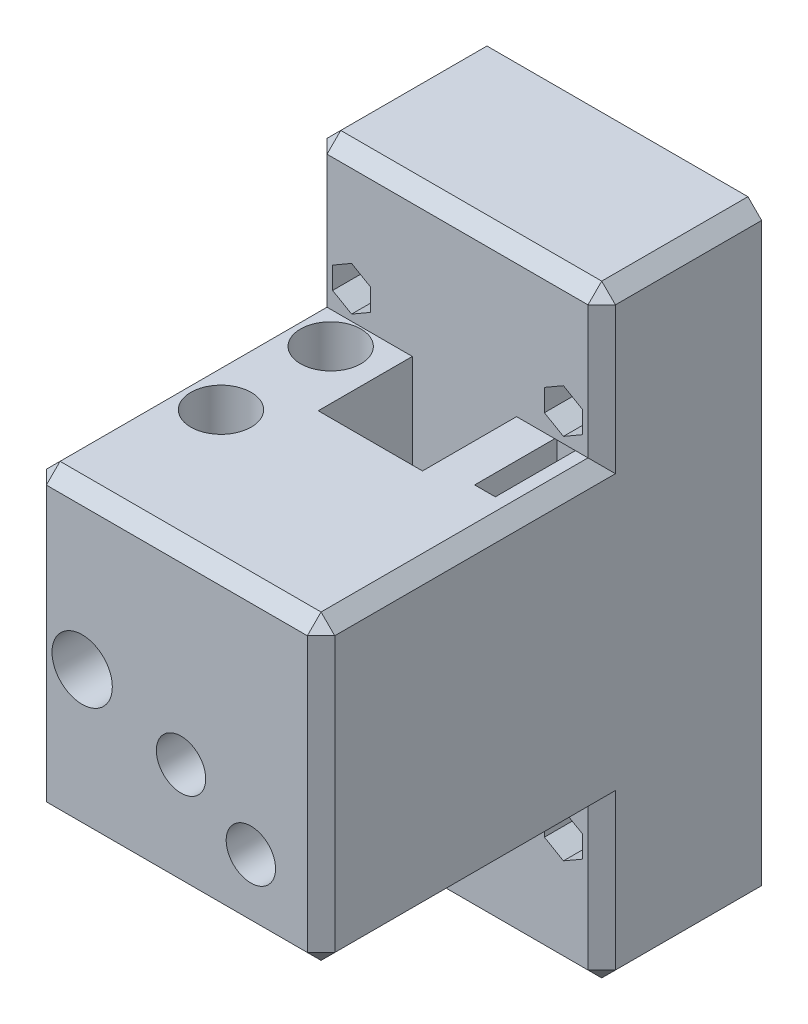
from build123d import *

# Parameters (mm, degrees)
SKETCH1_W                = 34.3
SKETCH1_H                = 70.3
SKETCH1_W_2              = 110
SKETCH1_H_2              = 9.85
BOSS_EXTRUDE1_DEPTH      = 15.048264774
BOSS_EXTRUDE3_DEPTH      = 10
BOSS_EXTRUDE4_DEPTH      = 27.518264774
CUT_EXTRUDE1_DEPTH       = 97.82308708
CUT_EXTRUDE1_DEPTH_BACK  = 97.82308708
SKETCH4_R                = 2
CUT_EXTRUDE3_DEPTH       = 77.2053469
CUT_EXTRUDE3_DEPTH_BACK  = 77.2053469
SKETCH8_W                = 129.903835659
SKETCH8_H                = 83.627886417
SKETCH9_W                = 44.357950904
SKETCH9_H                = 70.607950904
SKETCH9_W_2              = 20
SKETCH9_H_2              = 40
BOSS_EXTRUDE5_DEPTH      = 15.048264774
SKETCH10_W               = 20.2
SKETCH10_H               = 40.2
SKETCH10_W_2             = 20
SKETCH10_H_2             = 40
CUT_EXTRUDE6_DEPTH       = 81.359319258
SKETCH11_R               = 3
CUT_EXTRUDE7_DEPTH       = 30
CUT_EXTRUDE8_DEPTH       = 105.313703151
CUT_EXTRUDE8_DEPTH_BACK  = 8
SKETCH12_R               = 5.5
CUT_EXTRUDE10_DEPTH      = 81.359319258
CUT_EXTRUDE10_DEPTH_BACK = 81.359319258
SKETCH14_W               = 7.032197939
SKETCH14_H               = 32
SKETCH19_W               = 44.357950904
SKETCH19_H               = 70.453975452
BOSS_EXTRUDE9_DEPTH      = 3
BOSS_EXTRUDE6_DEPTH      = 19.3
SKETCH16_R               = 3.4
BOSS_EXTRUDE7_DEPTH      = 2.35
SKETCH18_W               = 18.048264774
SKETCH18_H               = 5.321024548
BOSS_EXTRUDE8_DEPTH      = 15
SKETCH20_R               = 3.4
BOSS_EXTRUDE10_DEPTH     = 1.85
BOSS_EXTRUDE11_DEPTH     = 15.85
SKETCH22_R               = 3.4
BOSS_EXTRUDE12_DEPTH     = 1.8
BOSS_EXTRUDE13_DEPTH     = 34.003975452
SKETCH26_W               = 18.048264774
SKETCH26_H               = 2.15
BOSS_EXTRUDE16_DEPTH     = 5.321024548
SKETCH24_R               = 3.4
BOSS_EXTRUDE14_DEPTH     = 1.8
BOSS_EXTRUDE15_DEPTH     = 18.503975452
CUT_EXTRUDE11_DEPTH      = 83.549671178
CUT_EXTRUDE11_DEPTH_BACK = 83.549671178
SKETCH27_R               = 2.5
CUT_EXTRUDE12_DEPTH      = 81.923545348
CUT_EXTRUDE12_DEPTH_BACK = 81.923545348
SKETCH28_R               = 2.5
CUT_EXTRUDE15_DEPTH      = 102.880674814
CUT_EXTRUDE15_DEPTH_BACK = 102.880674814
SKETCH29_W               = 3.770821646
SKETCH29_H               = 15
SKETCH30_W               = 52.566529548
SKETCH30_H               = 26.651024548
SKETCH30_R               = 2
SKETCH30_H_2             = 28.348975452
BOSS_EXTRUDE17_DEPTH     = 19.3
CHAMFER1_SIZE            = 2.5
CUT_EXTRUDE16_DEPTH      = 84.96040374
CUT_EXTRUDE16_DEPTH_BACK = 10
SKETCH31_R               = 3
CUT_EXTRUDE17_DEPTH      = 33
SKETCH33_R               = 5.5
CUT_EXTRUDE18_DEPTH      = 8
CUT_EXTRUDE19_DEPTH      = 20
CUT_EXTRUDE20_DEPTH      = 33
SKETCH36_R               = 4.5
CUT_EXTRUDE21_DEPTH      = 12
SKETCH37_R               = 4.5
CUT_EXTRUDE22_DEPTH      = 4


# Read off the part's stored shape, not the designer's step: Boss-Extrude13
with BuildPart() as part:
    # Sketch1 → Boss-Extrude1 (new body)
    # profile 1 of 2: a face of its own
    with BuildSketch(Plane.YZ):
        Rectangle(SKETCH1_W, SKETCH1_H)
        with BuildLine():
            Line((-10.15, 6.7), (-10.15, -6.7))
            ThreePointArc((-10.15, -6.7), (-9.871751442, -7.371751442), (-9.2, -7.65))
            Line((-9.2, -7.65), (-8.5, -7.65))
            ThreePointArc((-8.5, -7.65), (-8.181801948, -7.518198052), (-8.05, -7.2))
            Line((-8.05, -7.2), (-8.05, -5.094911614))
            ThreePointArc((-8.05, -5.094911614), (-7.621019548, -4.452896997), (-6.863711672, -4.603534899))
            Line((-6.863711672, -4.603534899), (-4.684745674, -6.782500897))
            ThreePointArc((-4.684745674, -6.782500897), (-4.066943332, -7.707107441), (-3.85, -8.797755224))
            Line((-3.85, -8.797755224), (-3.85, -11.202244776))
            ThreePointArc((-3.85, -11.202244776), (-4.066943332, -12.292892559), (-4.684745674, -13.217499103))
            Line((-4.684745674, -13.217499103), (-6.863711672, -15.396465101))
            ThreePointArc((-6.863711672, -15.396465101), (-7.621019548, -15.547103003), (-8.05, -14.905088386))
            Line((-8.05, -14.905088386), (-8.05, -12.8))
            ThreePointArc((-8.05, -12.8), (-8.181801948, -12.481801948), (-8.5, -12.35))
            Line((-8.5, -12.35), (-9.2, -12.35))
            ThreePointArc((-9.2, -12.35), (-9.871751442, -12.628248558), (-10.15, -13.3))
            Line((-10.15, -13.3), (-10.15, -18))
            ThreePointArc((-10.15, -18), (-9.52027958, -19.52027958), (-8, -20.15))
            Line((-8, -20.15), (-3.3, -20.15))
            ThreePointArc((-3.3, -20.15), (-2.628248558, -19.871751442), (-2.35, -19.2))
            Line((-2.35, -19.2), (-2.35, -18.5))
            ThreePointArc((-2.35, -18.5), (-2.481801948, -18.181801948), (-2.8, -18.05))
            Line((-2.8, -18.05), (-4.905088386, -18.05))
            ThreePointArc((-4.905088386, -18.05), (-5.547103003, -17.621019548), (-5.396465101, -16.863711672))
            Line((-5.396465101, -16.863711672), (-3.217499103, -14.684745674))
            ThreePointArc((-3.217499103, -14.684745674), (-2.292892559, -14.066943332), (-1.202244776, -13.85))
            Line((-1.202244776, -13.85), (1.202244776, -13.85))
            ThreePointArc((1.202244776, -13.85), (2.292892559, -14.066943332), (3.217499103, -14.684745674))
            Line((3.217499103, -14.684745674), (5.396465101, -16.863711672))
            ThreePointArc((5.396465101, -16.863711672), (5.547103003, -17.621019548), (4.905088386, -18.05))
            Line((4.905088386, -18.05), (2.8, -18.05))
            ThreePointArc((2.8, -18.05), (2.481801948, -18.181801948), (2.35, -18.5))
            Line((2.35, -18.5), (2.35, -19.2))
            ThreePointArc((2.35, -19.2), (2.628248558, -19.871751442), (3.3, -20.15))
            Line((3.3, -20.15), (8, -20.15))
            ThreePointArc((8, -20.15), (9.52027958, -19.52027958), (10.15, -18))
            Line((10.15, -18), (10.15, -13.3))
            ThreePointArc((10.15, -13.3), (9.871751442, -12.628248558), (9.2, -12.35))
            Line((9.2, -12.35), (8.5, -12.35))
            ThreePointArc((8.5, -12.35), (8.181801948, -12.481801948), (8.05, -12.8))
            Line((8.05, -12.8), (8.05, -14.905088386))
            ThreePointArc((8.05, -14.905088386), (7.621019548, -15.547103003), (6.863711672, -15.396465101))
            Line((6.863711672, -15.396465101), (4.684745674, -13.217499103))
            ThreePointArc((4.684745674, -13.217499103), (4.066943332, -12.292892559), (3.85, -11.202244776))
            Line((3.85, -11.202244776), (3.85, -8.797755224))
            ThreePointArc((3.85, -8.797755224), (4.066943332, -7.707107441), (4.684745674, -6.782500897))
            Line((4.684745674, -6.782500897), (6.863711672, -4.603534899))
            ThreePointArc((6.863711672, -4.603534899), (7.621019548, -4.452896997), (8.05, -5.094911614))
            Line((8.05, -5.094911614), (8.05, -7.2))
            ThreePointArc((8.05, -7.2), (8.181801948, -7.518198052), (8.5, -7.65))
            Line((8.5, -7.65), (9.2, -7.65))
            ThreePointArc((9.2, -7.65), (9.871751442, -7.371751442), (10.15, -6.7))
            Line((10.15, -6.7), (10.15, 6.7))
            ThreePointArc((10.15, 6.7), (9.871751442, 7.371751442), (9.2, 7.65))
            Line((9.2, 7.65), (8.5, 7.65))
            ThreePointArc((8.5, 7.65), (8.181801948, 7.518198052), (8.05, 7.2))
            Line((8.05, 7.2), (8.05, 5.094911614))
            ThreePointArc((8.05, 5.094911614), (7.621019548, 4.452896997), (6.863711672, 4.603534899))
            Line((6.863711672, 4.603534899), (4.684745674, 6.782500897))
            ThreePointArc((4.684745674, 6.782500897), (4.066943332, 7.707107441), (3.85, 8.797755224))
            Line((3.85, 8.797755224), (3.85, 11.202244776))
            ThreePointArc((3.85, 11.202244776), (4.066943332, 12.292892559), (4.684745674, 13.217499103))
            Line((4.684745674, 13.217499103), (6.863711672, 15.396465101))
            ThreePointArc((6.863711672, 15.396465101), (7.621019548, 15.547103003), (8.05, 14.905088386))
            Line((8.05, 14.905088386), (8.05, 12.8))
            ThreePointArc((8.05, 12.8), (8.181801948, 12.481801948), (8.5, 12.35))
            Line((8.5, 12.35), (9.2, 12.35))
            ThreePointArc((9.2, 12.35), (9.871751442, 12.628248558), (10.15, 13.3))
            Line((10.15, 13.3), (10.15, 18))
            ThreePointArc((10.15, 18), (9.52027958, 19.52027958), (8, 20.15))
            Line((8, 20.15), (3.3, 20.15))
            ThreePointArc((3.3, 20.15), (2.628248558, 19.871751442), (2.35, 19.2))
            Line((2.35, 19.2), (2.35, 18.5))
            ThreePointArc((2.35, 18.5), (2.481801948, 18.181801948), (2.8, 18.05))
            Line((2.8, 18.05), (4.905088386, 18.05))
            ThreePointArc((4.905088386, 18.05), (5.547103003, 17.621019548), (5.396465101, 16.863711672))
            Line((5.396465101, 16.863711672), (3.217499103, 14.684745674))
            ThreePointArc((3.217499103, 14.684745674), (2.292892559, 14.066943332), (1.202244776, 13.85))
            Line((1.202244776, 13.85), (-1.202244776, 13.85))
            ThreePointArc((-1.202244776, 13.85), (-2.292892559, 14.066943332), (-3.217499103, 14.684745674))
            Line((-3.217499103, 14.684745674), (-5.396465101, 16.863711672))
            ThreePointArc((-5.396465101, 16.863711672), (-5.547103003, 17.621019548), (-4.905088386, 18.05))
            Line((-4.905088386, 18.05), (-2.8, 18.05))
            ThreePointArc((-2.8, 18.05), (-2.481801948, 18.181801948), (-2.35, 18.5))
            Line((-2.35, 18.5), (-2.35, 19.2))
            ThreePointArc((-2.35, 19.2), (-2.628248558, 19.871751442), (-3.3, 20.15))
            Line((-3.3, 20.15), (-8, 20.15))
            ThreePointArc((-8, 20.15), (-9.52027958, 19.52027958), (-10.15, 18))
            Line((-10.15, 18), (-10.15, 13.3))
            ThreePointArc((-10.15, 13.3), (-9.871751442, 12.628248558), (-9.2, 12.35))
            Line((-9.2, 12.35), (-8.5, 12.35))
            ThreePointArc((-8.5, 12.35), (-8.181801948, 12.481801948), (-8.05, 12.8))
            Line((-8.05, 12.8), (-8.05, 14.905088386))
            ThreePointArc((-8.05, 14.905088386), (-7.621019548, 15.547103003), (-6.863711672, 15.396465101))
            Line((-6.863711672, 15.396465101), (-4.684745674, 13.217499103))
            ThreePointArc((-4.684745674, 13.217499103), (-4.066943332, 12.292892559), (-3.85, 11.202244776))
            Line((-3.85, 11.202244776), (-3.85, 8.797755224))
            ThreePointArc((-3.85, 8.797755224), (-4.066943332, 7.707107441), (-4.684745674, 6.782500897))
            Line((-4.684745674, 6.782500897), (-6.863711672, 4.603534899))
            ThreePointArc((-6.863711672, 4.603534899), (-7.621019548, 4.452896997), (-8.05, 5.094911614))
            Line((-8.05, 5.094911614), (-8.05, 7.2))
            ThreePointArc((-8.05, 7.2), (-8.181801948, 7.518198052), (-8.5, 7.65))
            Line((-8.5, 7.65), (-9.2, 7.65))
            ThreePointArc((-9.2, 7.65), (-9.871751442, 7.371751442), (-10.15, 6.7))
        make_face(mode=Mode.SUBTRACT)
    # profile 2 of 2: a face of its own
    with BuildSketch(Plane.YZ):
        with Locations((0, -40.075)):
            Rectangle(SKETCH1_W_2, SKETCH1_H_2)
    extrude(amount=-BOSS_EXTRUDE1_DEPTH)

    # Sketch2 → Boss-Extrude3 (add)
    with BuildSketch(Plane.YZ):
        Polygon((17.15, 35.15), (-17.15, 35.15), (-17.15, -35.15), (-55, -35.15), (-55, -45), (55, -45), (55, -35.15), (17.15, -35.15), align=None)
    extrude(amount=BOSS_EXTRUDE3_DEPTH)

    # Sketch3 → Boss-Extrude4 (add)
    with BuildSketch(Plane.YZ.offset(10)):
        Polygon((-17.15, -35.15), (17.15, -35.15), (55, -35.15), (55, -45), (-55, -45), (-55, -35.15), align=None)
    extrude(amount=BOSS_EXTRUDE4_DEPTH)

    # Sketch4 → Cut-Extrude1 (cut, two sides: drawn at the far end of the back side and taken through both)
    with BuildSketch(Plane.XY.offset(-35.15).offset(-CUT_EXTRUDE1_DEPTH_BACK)):
        with Locations((-8.06818722, 33.5)):
            Circle(SKETCH4_R)
        with Locations((-8.06818722, -33.5)):
            Circle(SKETCH4_R)
        with Locations((30.53818722, -33.5)):
            Circle(SKETCH4_R)
        with Locations((30.53818722, 33.5)):
            Circle(SKETCH4_R)
    extrude(amount=CUT_EXTRUDE1_DEPTH + CUT_EXTRUDE1_DEPTH_BACK, mode=Mode.SUBTRACT)

    # Sketch8 → Cut-Extrude3 (cut, two sides: drawn at the far end of the back side and taken through both)
    with BuildSketch(Plane.YZ.offset(10).offset(-CUT_EXTRUDE3_DEPTH_BACK)):
        with Locations((-9.95191783, 6.663943208)):
            Rectangle(SKETCH8_W, SKETCH8_H)
    extrude(amount=CUT_EXTRUDE3_DEPTH + CUT_EXTRUDE3_DEPTH_BACK, mode=Mode.SUBTRACT)

    # Sketch9 → Boss-Extrude5 (add)
    with BuildSketch(Plane(origin=(-15.048264774, 0, 0), x_dir=(0, -1, 0), z_dir=(-1, 0, 0))):
        with Locations((-0.848975452, 0)):
            Rectangle(SKETCH9_W, SKETCH9_H)
        Rectangle(SKETCH9_W_2, SKETCH9_H_2, mode=Mode.SUBTRACT)
    extrude(amount=-BOSS_EXTRUDE5_DEPTH)

    # Sketch10 → Cut-Extrude6 (cut, through all)
    with BuildSketch(Plane.YZ):
        Rectangle(SKETCH10_W, SKETCH10_H)
        Rectangle(SKETCH10_W_2, SKETCH10_H_2, mode=Mode.SUBTRACT)
    extrude(amount=-CUT_EXTRUDE6_DEPTH, mode=Mode.SUBTRACT)

    # Sketch11 → Cut-Extrude7 (cut)
    with BuildSketch(Plane.XY.offset(35.303975452)):
        with Locations((-6.024132387, 0)):
            Circle(SKETCH11_R)
    extrude(amount=-CUT_EXTRUDE7_DEPTH, mode=Mode.SUBTRACT)

    # Sketch12 → Cut-Extrude8 (cut, two sides: drawn at the far end of the back side and taken through both)
    with BuildSketch(Plane.XY.offset(35.303975452).offset(-CUT_EXTRUDE8_DEPTH_BACK)):
        with Locations((-6.024132387, 0)):
            Circle(SKETCH12_R)
    extrude(amount=CUT_EXTRUDE8_DEPTH + CUT_EXTRUDE8_DEPTH_BACK, mode=Mode.SUBTRACT)

    # Sketch14 → Cut-Extrude10 (cut, two sides: drawn at the far end of the back side and taken through both)
    with BuildSketch(Plane.YZ.offset(-CUT_EXTRUDE10_DEPTH_BACK)):
        with Locations((-12.813901031, 0.15)):
            Rectangle(SKETCH14_W, SKETCH14_H)
    extrude(amount=CUT_EXTRUDE10_DEPTH + CUT_EXTRUDE10_DEPTH_BACK, mode=Mode.SUBTRACT)

    # Sketch19 → Boss-Extrude9 (add)
    # profile 1 of 2: a face of its own
    with BuildSketch(Plane.YZ):
        with Locations((0.848975452, 0.076987726)):
            Rectangle(SKETCH19_W, SKETCH19_H)
        Polygon((-16.33, -15.85), (-16.33, 16.15), (-10.1, 16.15), (-10.1, 20.1), (10.1, 20.1), (10.1, -20.1), (-10.1, -20.1), (-10.1, -15.85), align=None, mode=Mode.SUBTRACT)
    # profile 2 of 2: a face of its own
    with BuildSketch(Plane.YZ):
        Polygon((-10.1, 16.15), (-10.1, -15.85), (-10.1, -20.1), (10.1, -20.1), (10.1, 20.1), (-10.1, 20.1), align=None)
    extrude(amount=BOSS_EXTRUDE9_DEPTH)

    # Sketch15 → Boss-Extrude6 (add)
    with BuildSketch(Plane.XY.offset(-35.15)):
        Polygon((37.518264774, 28.348975452), (-15.048264774, 28.348975452), (-15.048264774, 23.027950904), (3, 23.027950904), (3, -21.33), (-15.048264774, -21.33), (-15.048264774, -26.651024548), (37.518264774, -26.651024548), align=None)
    extrude(amount=BOSS_EXTRUDE6_DEPTH)

    # Sketch16 → Boss-Extrude7 (add)
    with BuildSketch(Plane.XY.offset(-15.85)):
        with Locations(Location((12, -6, 0), (0, 0, 180))):
            Circle(SKETCH16_R)
    extrude(amount=BOSS_EXTRUDE7_DEPTH)

    # Sketch18 → Boss-Extrude8 (add)
    with BuildSketch(Plane.XY.offset(-15.85)):
        with BuildLine():
            ThreePointArc((22, -6), (19.196963711, -12.942889409), (12.359257331, -15.993544625))
            Line((12.359257331, -15.993544625), (3, -16.33))
            Line((3, -16.33), (3, -21.33))
            Line((3, -21.33), (-15.048264774, -21.33))
            Line((-15.048264774, -21.33), (-15.048264774, -26.651024548))
            Line((-15.048264774, -26.651024548), (37.518264774, -26.651024548))
            Line((37.518264774, -26.651024548), (37.518264774, 28.348975452))
            Line((37.518264774, 28.348975452), (22, 28.348975452))
            Line((22, 28.348975452), (22, -6))
        make_face()
        with Locations((-6.024132387, 25.688463178)):
            Rectangle(SKETCH18_W, SKETCH18_H)
    extrude(amount=BOSS_EXTRUDE8_DEPTH)

    # Sketch20 → Boss-Extrude10 (add)
    with BuildSketch(Plane.XY.offset(-0.85)):
        with Locations((24.73, -13.83)):
            Circle(SKETCH20_R)
    extrude(amount=BOSS_EXTRUDE10_DEPTH)

    # Sketch21 → Boss-Extrude11 (add)
    with BuildSketch(Plane.XY.offset(-0.85)):
        Polygon((-15.048264774, -26.651024548), (14.73, -26.651024548), (14.73, -16.33), (3, -16.33), (3, -21.33), (-15.048264774, -21.33), align=None)
        with BuildLine():
            Line((34.73, -13.83), (34.73, -26.651024548))
            Line((34.73, -26.651024548), (37.518264774, -26.651024548))
            Line((37.518264774, -26.651024548), (37.518264774, 28.348975452))
            Line((37.518264774, 28.348975452), (22, 28.348975452))
            Line((22, 28.348975452), (22, -3.83))
            Line((22, -3.83), (24.73, -3.83))
            ThreePointArc((24.73, -3.83), (31.801067812, -6.758932188), (34.73, -13.83))
        make_face()
    extrude(amount=BOSS_EXTRUDE11_DEPTH)

    # Boss-Extrude13 outline → Boss-Extrude13 (add)
    with BuildSketch(Plane.XY.offset(1.3)):
        with BuildLine():
            Line((22, -6), (22, 28.348975452))
            Line((22, 28.348975452), (-15.048264774, 28.348975452))
            Line((-15.048264774, 28.348975452), (-15.048264774, 23.027950904))
            Line((-15.048264774, 23.027950904), (3, 23.027950904))
            Line((3, 23.027950904), (3, -10.1))
            Line((3, -10.1), (21.566632564, -8.91196521))
            ThreePointArc((21.566632564, -8.91196521), (21.891064797, -7.472018064), (22, -6))
        make_face()
    extrude(amount=BOSS_EXTRUDE13_DEPTH)

    # Sketch26 → Boss-Extrude16 (add)
    with BuildSketch(Plane(origin=(0, 23.027950904, 0), x_dir=(-1, 0, 0), z_dir=(0, 1, 0))):
        with Locations((6.024132387, 0.225)):
            Rectangle(SKETCH26_W, SKETCH26_H)
    extrude(amount=BOSS_EXTRUDE16_DEPTH)

    # Sketch24 → Boss-Extrude14 (add)
    with BuildSketch(Plane.XY.offset(15)):
        with Locations((24.73, -18.73)):
            Circle(SKETCH24_R)
        Polygon((14.73, -16.33), (3, -16.33), (3, -21.33), (-15.048264774, -21.33), (-15.048264774, -26.651024548), (14.73, -26.651024548), align=None)
        with BuildLine():
            Line((34.73, -13.83), (34.73, -26.651024548))
            Line((34.73, -26.651024548), (37.518264774, -26.651024548))
            Line((37.518264774, -26.651024548), (37.518264774, 28.348975452))
            Line((37.518264774, 28.348975452), (22, 28.348975452))
            Line((22, 28.348975452), (22, -3.83))
            Line((22, -3.83), (24.73, -3.83))
            ThreePointArc((24.73, -3.83), (31.801067812, -6.758932188), (34.73, -13.83))
        make_face()
    extrude(amount=BOSS_EXTRUDE14_DEPTH)


with BuildPart() as body_2:
    # Sketch22 → Boss-Extrude12 (new body)
    with BuildSketch(Plane(origin=(0, 0, -0.5), x_dir=(0, -1, 0), z_dir=(0, 0, 1))):
        with Locations(Location((28.33, 12, 0), (0, 0, 90))):
            Circle(SKETCH22_R)
    extrude(amount=BOSS_EXTRUDE12_DEPTH)


with BuildPart() as boss_extrude14_piece_1:
    # of the separate pieces the step leaves, piece 1, a body of its own (boss_extrude14_pieces)
    add(part.part.solids().sort_by_distance((-15.048264774, -55, -45))[0])



with BuildPart() as boss_extrude14_piece_2:
    # of the separate pieces the step leaves, piece 2, a body of its own (boss_extrude14_pieces)
    add(part.part.solids().sort_by_distance((28.13, -18.73, 15))[0])


with BuildPart() as boss_extrude14_piece_1_1:
    add(boss_extrude14_piece_1.part)

    add(boss_extrude14_piece_2.part)  # Boss-Extrude15 merges Boss-Extrude14 piece 2
    # Sketch25 → Boss-Extrude15 (add)
    with BuildSketch(Plane.XY.offset(16.8)):
        Polygon((-15.048264774, -26.651024548), (14.73, -26.651024548), (14.73, -16.33), (3, -16.33), (3, -21.33), (-15.048264774, -21.33), align=None)
        with BuildLine():
            Line((37.518264774, 28.348975452), (22, 28.348975452))
            Line((22, 28.348975452), (22, -6))
            ThreePointArc((22, -6), (21.904579832, -7.378150334), (21.620140332, -8.73))
            Line((21.620140332, -8.73), (24.73, -8.73))
            ThreePointArc((24.73, -8.73), (31.801067812, -11.658932188), (34.73, -18.73))
            Line((34.73, -18.73), (34.73, -26.651024548))
            Line((34.73, -26.651024548), (37.518264774, -26.651024548))
            Line((37.518264774, -26.651024548), (37.518264774, 28.348975452))
        make_face()
        with BuildLine():
            Line((24.73, -8.73), (21.620140332, -8.73))
            ThreePointArc((21.620140332, -8.73), (18.171455627, -13.868490036), (12.359257331, -15.993544625))
            Line((12.359257331, -15.993544625), (3, -16.33))
            Line((3, -16.33), (14.73, -16.33))
            Line((14.73, -16.33), (14.73, -26.651024548))
            Line((14.73, -26.651024548), (34.73, -26.651024548))
            Line((34.73, -26.651024548), (34.73, -18.73))
            ThreePointArc((34.73, -18.73), (31.801067812, -11.658932188), (24.73, -8.73))
        make_face()
        with BuildLine():
            Line((3, -16.33), (12.359257331, -15.993544625))
            ThreePointArc((12.359257331, -15.993544625), (19.196963711, -12.942889409), (22, -6))
            Line((22, -6), (22, 28.348975452))
            Line((22, 28.348975452), (3, 28.348975452))
            Line((3, 28.348975452), (3, -10.1))
            Line((3, -10.1), (0, -10.1))
            Line((0, -10.1), (-15.048264774, -10.1))
            Line((-15.048264774, -10.1), (-15.048264774, -16.33))
            Line((-15.048264774, -16.33), (3, -16.33))
        make_face()
    extrude(amount=BOSS_EXTRUDE15_DEPTH)

    # Sketch27 → Cut-Extrude11 (cut, two sides: drawn at the far end of the back side and taken through both)
    with BuildSketch(Plane.XY.offset(-13.5).offset(-CUT_EXTRUDE11_DEPTH_BACK)):
        with Locations((12, -6)):
            Circle(SKETCH27_R)
    extrude(amount=CUT_EXTRUDE11_DEPTH + CUT_EXTRUDE11_DEPTH_BACK, mode=Mode.SUBTRACT)

    # Sketch28 → Cut-Extrude12 (cut, two sides: drawn at the far end of the back side and taken through both)
    with BuildSketch(Plane.XY.offset(1).offset(-CUT_EXTRUDE12_DEPTH_BACK)):
        with Locations((24.73, -13.83)):
            Circle(SKETCH28_R)
    extrude(amount=CUT_EXTRUDE12_DEPTH + CUT_EXTRUDE12_DEPTH_BACK, mode=Mode.SUBTRACT)

    # Sketch29 → Cut-Extrude15 (cut, two sides: drawn at the far end of the back side and taken through both)
    with BuildSketch(Plane(origin=(0, 28.348975452, 0), x_dir=(-1, 0, 0), z_dir=(0, 1, 0)).offset(-CUT_EXTRUDE15_DEPTH_BACK)):
        with Locations((-30.844589177, -8.75)):
            Rectangle(SKETCH29_W, SKETCH29_H)
    extrude(amount=CUT_EXTRUDE15_DEPTH + CUT_EXTRUDE15_DEPTH_BACK, mode=Mode.SUBTRACT)

    # Sketch30 → Boss-Extrude17 (add)
    # profile 1 of 2: a face of its own
    with BuildSketch(Plane.XY.offset(-35.15)):
        with Locations((11.235, 41.674487726)):
            Rectangle(SKETCH30_W, SKETCH30_H)
        with Locations((30.53818722, 33.5)):
            Circle(SKETCH30_R, mode=Mode.SUBTRACT)
        with Locations((-8.06818722, 33.5)):
            Circle(SKETCH30_R, mode=Mode.SUBTRACT)
    # profile 2 of 2: a face of its own
    with BuildSketch(Plane.XY.offset(-35.15)):
        with Locations((11.235, -40.825512274)):
            Rectangle(SKETCH30_W, SKETCH30_H_2)
        with Locations((-8.06818722, -33.5)):
            Circle(SKETCH30_R, mode=Mode.SUBTRACT)
        with Locations((30.53818722, -33.5)):
            Circle(SKETCH30_R, mode=Mode.SUBTRACT)
    extrude(amount=BOSS_EXTRUDE17_DEPTH)

    # Chamfer1
    chamfer1_edges = [boss_extrude14_piece_1_1.edges().sort_by_distance(p)[0] for p in [
        (11.235, 55, -15.85),
        (-15.048264774, 41.674487726, -15.85),
        (37.518264774, 41.674487726, -15.85),
        (37.518264774, -40.825512274, -15.85),
        (-15.048264774, -40.825512274, -15.85),
        (11.235, -55, -15.85),
        (11.235, -26.651024548, 35.303975452),
        (-15.048264774, -26.651024548, 9.726987726),
        (-15.048264774, 6.463975452, 35.303975452),
        (11.235, 28.348975452, 35.303975452),
        (37.518264774, 28.348975452, 9.726987726),
        (37.518264774, 0.848975452, 35.303975452),
        (37.518264774, -26.651024548, 9.726987726),
        (-15.048264774, 28.348975452, 18.301987726),
        (-15.048264774, -55, -25.5),
        (37.518264774, -55, -25.5),
        (-15.048264774, 55, -25.5),
        (37.518264774, 55, -25.5),
    ]]
    chamfer(chamfer1_edges, length=CHAMFER1_SIZE)

    # Sketch32 → Cut-Extrude16 (cut, two sides: drawn at the far end of the back side and taken through both)
    with BuildSketch(Plane.XY.offset(-15.85).offset(-CUT_EXTRUDE16_DEPTH_BACK)):
        Polygon((-4.604085605, 35.5), (-8.06818722, 37.5), (-11.532288835, 35.5), (-11.532288835, 31.5), (-8.06818722, 29.5), (-4.604085605, 31.5), align=None)
        Polygon((30.53818722, 29.5), (34.002288835, 31.5), (34.002288835, 35.5), (30.53818722, 37.5), (27.074085604, 35.5), (27.074085604, 31.5), align=None)
        Polygon((-8.06818722, -37.5), (-4.604085605, -35.5), (-4.604085605, -31.5), (-8.06818722, -29.5), (-11.532288835, -31.5), (-11.532288835, -35.5), align=None)
        Polygon((30.53818722, -37.5), (34.002288835, -35.5), (34.002288835, -31.5), (30.53818722, -29.5), (27.074085604, -31.5), (27.074085604, -35.5), align=None)
    extrude(amount=CUT_EXTRUDE16_DEPTH + CUT_EXTRUDE16_DEPTH_BACK, mode=Mode.SUBTRACT)

    # Sketch31 → Cut-Extrude17 (cut)
    with BuildSketch(Plane(origin=(0, 3.7, 0), x_dir=(-1, 0, 0), z_dir=(0, 1, 0))):
        with Locations(Location((6.024132387, -10, 0), (0, 0, 270))):
            Circle(SKETCH31_R)
        with Locations(Location((6.024132387, 10, 0), (0, 0, 270))):
            Circle(SKETCH31_R)
    extrude(amount=CUT_EXTRUDE17_DEPTH, mode=Mode.SUBTRACT)

    # Sketch33 → Cut-Extrude18 (cut)
    with BuildSketch(Plane(origin=(0, 28.348975452, 0), x_dir=(-1, 0, 0), z_dir=(0, 1, 0))):
        with Locations(Location((6.024132387, 10, 0), (0, 0, 90))):
            Circle(SKETCH33_R)
        with Locations(Location((6.024132387, -10, 0), (0, 0, 90))):
            Circle(SKETCH33_R)
    extrude(amount=-CUT_EXTRUDE18_DEPTH, mode=Mode.SUBTRACT)

    # Sketch34 → Cut-Extrude19 (cut)
    with BuildSketch(Plane(origin=(0, 0, -45), x_dir=(1, 0, 0), z_dir=(0, 0, -1))):
        Polygon((12, 1.25), (16.113620668, 3.625), (16.113620668, 8.375), (12, 10.75), (7.886379332, 8.375), (7.886379332, 3.625), align=None)
    extrude(amount=-CUT_EXTRUDE19_DEPTH, mode=Mode.SUBTRACT)

    # Sketch35 → Cut-Extrude20 (cut)
    with BuildSketch(Plane(origin=(0, 0, -45), x_dir=(1, 0, 0), z_dir=(0, 0, -1))):
        Polygon((24.73, 9.08), (28.843620668, 11.455), (28.843620668, 16.205), (24.73, 18.58), (20.616379332, 16.205), (20.616379332, 11.455), align=None)
    extrude(amount=-CUT_EXTRUDE20_DEPTH, mode=Mode.SUBTRACT)

    # Sketch36 → Cut-Extrude21 (cut)
    with BuildSketch(Plane.XY.offset(35.303975452)):
        with Locations((12, -6)):
            Circle(SKETCH36_R)
        with Locations((24.73, -13.83)):
            Circle(SKETCH36_R)
    extrude(amount=-CUT_EXTRUDE21_DEPTH, mode=Mode.SUBTRACT)

    # Sketch37 → Cut-Extrude22 (cut)
    with BuildSketch(Plane.XY.offset(23.303975452)):
        with Locations((12, -6)):
            Circle(SKETCH37_R)
    extrude(amount=-CUT_EXTRUDE22_DEPTH, mode=Mode.SUBTRACT)


solid = Compound([body_2.part, boss_extrude14_piece_1_1.part])
